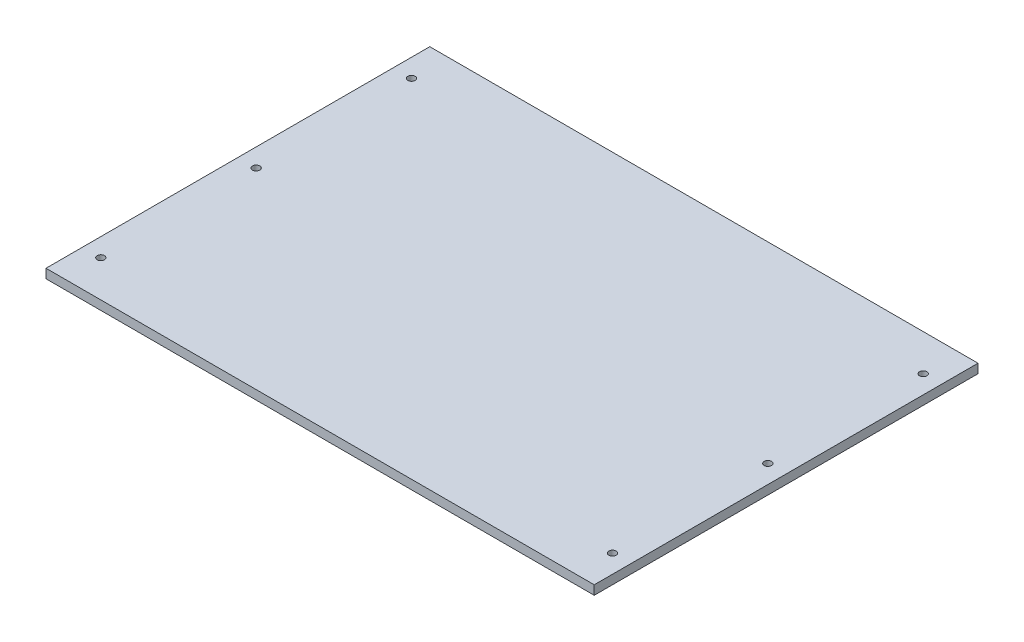
from build123d import *

# Parameters (mm, degrees)
SKETCH1_W           = 300
SKETCH1_H           = 210
SKETCH1_R           = 2
BOSS_EXTRUDE1_DEPTH = 5


with BuildPart() as part:
    # Sketch1 → Boss-Extrude1 (new body)
    with BuildSketch(Plane(origin=(0, 0, 0), x_dir=(1, 0, 0), z_dir=(0, 1, 0))):
        Rectangle(SKETCH1_W, SKETCH1_H)
        with Locations((-140, 85)):
            Circle(SKETCH1_R, mode=Mode.SUBTRACT)
        with Locations((-140, -85)):
            Circle(SKETCH1_R, mode=Mode.SUBTRACT)
        with Locations((-140, 0)):
            Circle(SKETCH1_R, mode=Mode.SUBTRACT)
        with Locations((140, -85)):
            Circle(SKETCH1_R, mode=Mode.SUBTRACT)
        with Locations((140, 0)):
            Circle(SKETCH1_R, mode=Mode.SUBTRACT)
        with Locations((140, 85)):
            Circle(SKETCH1_R, mode=Mode.SUBTRACT)
    extrude(amount=BOSS_EXTRUDE1_DEPTH)


solid = part.part
